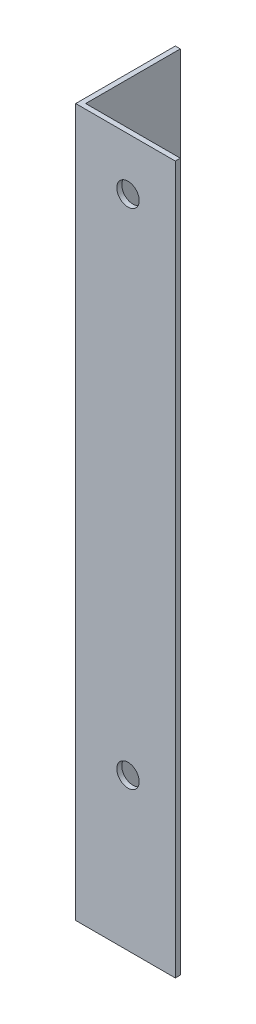
from build123d import *

# Parameters (mm, degrees)
EXTRUDE_1_DEPTH     = 142
SKETCH_2_R          = 2.25
CUT_EXTRUDE_1_DEPTH = 145.654761415
SKETCH_3_R          = 2.25
CUT_EXTRUDE_2_DEPTH = 145.789502382


with BuildPart() as part:
    # Эскиз1 → Бобышка-Вытянуть1 (new body)
    with BuildSketch(Plane(origin=(0, 0, 0), x_dir=(1, 0, 0), z_dir=(0, 1, 0))):
        Polygon((0, 0), (0, 20), (1, 20), (1, 1), (20, 1), (20, 0), align=None)
    extrude(amount=EXTRUDE_1_DEPTH)

    # Эскиз2 → Вырез-Вытянуть1 (cut, through all)
    with BuildSketch(Plane(origin=(0, 0, -1), x_dir=(-1, 0, 0), z_dir=(0, 0, -1))):
        with Locations((-10.5, 131.5)):
            Circle(SKETCH_2_R)
    extrude(amount=-CUT_EXTRUDE_1_DEPTH, mode=Mode.SUBTRACT)

    # Эскиз3 → Вырез-Вытянуть2 (cut, through all)
    with BuildSketch(Plane.XY):
        with Locations((10.5, 30.5)):
            Circle(SKETCH_3_R)
    extrude(amount=-CUT_EXTRUDE_2_DEPTH, mode=Mode.SUBTRACT)


solid = part.part
